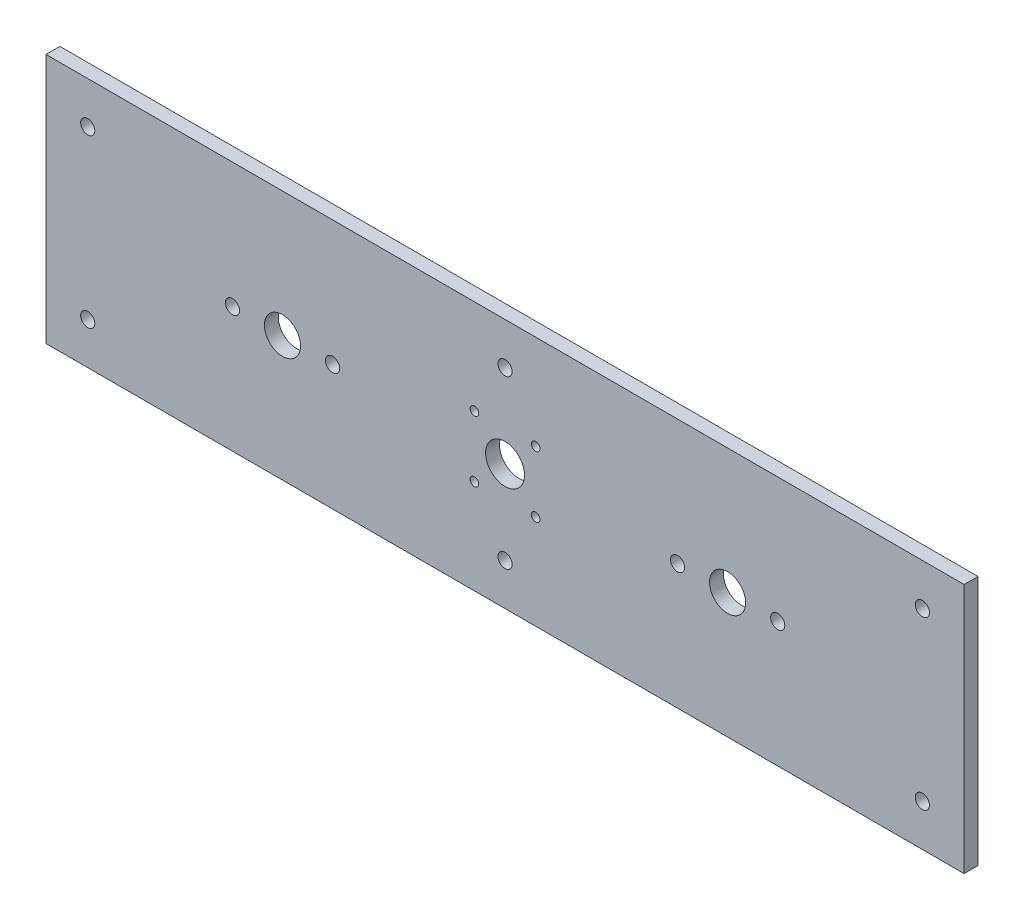
from build123d import *

# Parameters (mm, degrees)
SKETCH1_W           = 330
SKETCH1_H           = 90
BOSS_EXTRUDE1_DEPTH = 2.5
SKETCH2_R           = 2.55
CUT_EXTRUDE1_DEPTH  = 172.099386323
SKETCH3_R           = 6.5
SKETCH3_R_2         = 2.55
CUT_EXTRUDE2_DEPTH  = 172.099386323
SKETCH4_R           = 1.55
SKETCH4_R_2         = 7
CUT_EXTRUDE3_DEPTH  = 172.099386323


with BuildPart() as part:
    # Sketch1 → Boss-Extrude1 (new, symmetric)
    with BuildSketch(Plane.XY):
        Rectangle(SKETCH1_W, SKETCH1_H)
    extrude(amount=BOSS_EXTRUDE1_DEPTH, both=True)

    # Sketch2 → Cut-Extrude1 (cut, through all)
    with BuildSketch(Plane.XY.offset(2.5)):
        with Locations((150, 30)):
            Circle(SKETCH2_R)
        with Locations((150, -30)):
            Circle(SKETCH2_R)
        with Locations((0, 30)):
            Circle(SKETCH2_R)
        with Locations((0, -30)):
            Circle(SKETCH2_R)
        with Locations((-150, -30)):
            Circle(SKETCH2_R)
        with Locations((-150, 30)):
            Circle(SKETCH2_R)
    extrude(amount=-CUT_EXTRUDE1_DEPTH, mode=Mode.SUBTRACT)

    # Sketch3 → Cut-Extrude2 (cut, through all)
    with BuildSketch(Plane.XY.offset(2.5)):
        with Locations((-80, 0)):
            Circle(SKETCH3_R)
        with Locations((-62, 0)):
            Circle(SKETCH3_R_2)
        with Locations((-98, 0)):
            Circle(SKETCH3_R_2)
    cut_extrude2 = extrude(amount=-CUT_EXTRUDE2_DEPTH, mode=Mode.SUBTRACT)

    # Mirror1: Cut-Extrude2 across plane
    add(cut_extrude2.mirror(Plane(origin=(0, 0, 0), x_dir=(0, 0, 1), z_dir=(1, 0, 0))), mode=Mode.SUBTRACT)

    # Sketch4 → Cut-Extrude3 (cut, through all)
    with BuildSketch(Plane.XY.offset(2.5)):
        with Locations((11, 11)):
            Circle(SKETCH4_R)
        with Locations((11, -11)):
            Circle(SKETCH4_R)
        with Locations((-11, -11)):
            Circle(SKETCH4_R)
        with Locations((-11, 11)):
            Circle(SKETCH4_R)
        Circle(SKETCH4_R_2)
    extrude(amount=-CUT_EXTRUDE3_DEPTH, mode=Mode.SUBTRACT)


solid = part.part
